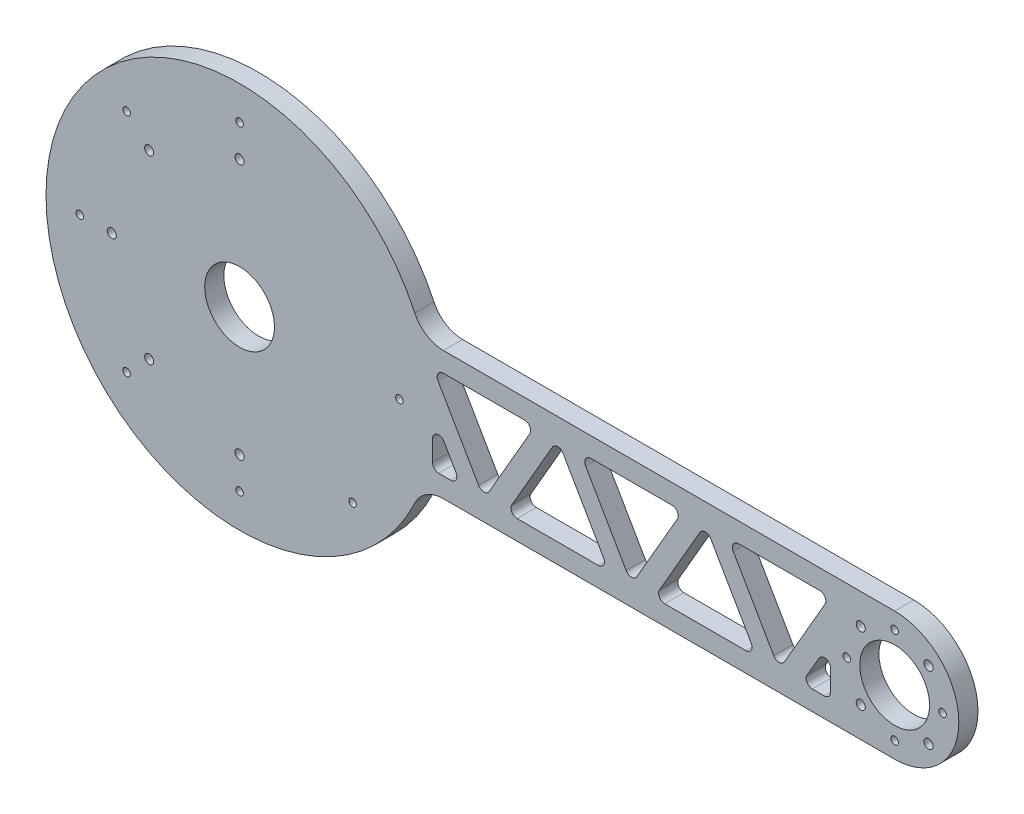
from build123d import *

# Parameters (mm, degrees)
SKETCH1_R              = 11
SKETCH1_R_2            = 1.25
SKETCH1_R_3            = 1.5
BOSS_EXTRUDE1_DEPTH    = 6
FILLET1_R              = 10
CUT_EXTRUDE1_DEPTH     = 234.069195734
FILLET2_R              = 2
MOVE_FACE1_OUTLINE_R   = 11
MOVE_FACE1_OUTLINE_R_2 = 10.92
MOVE_FACE1_OUTLINE_R_3 = 1.25
MOVE_FACE1_OUTLINE_R_4 = 1.17
MOVE_FACE1_OUTLINE_R_5 = 1.5
MOVE_FACE1_OUTLINE_R_6 = 1.42
MOVE_FACE1_DEPTH       = 6


# Read off the part's stored shape, not the designer's step: Move Face1
with BuildPart() as part:
    # Sketch1 → Boss-Extrude1 (new body)
    with BuildSketch(Plane.XY):
        with BuildLine():
            Line((57.098598932, -20), (205, -20))
            ThreePointArc((205, -20), (225, 0), (205, 20))
            Line((205, 20), (57.098598932, 20))
            ThreePointArc((57.098598932, 20), (-60.5, 0), (57.098598932, -20))
        make_face()
        Circle(SKETCH1_R, mode=Mode.SUBTRACT)
        with Locations((205, 0)):
            Circle(SKETCH1_R, mode=Mode.SUBTRACT)
        with Locations((205, -15)):
            Circle(SKETCH1_R_2, mode=Mode.SUBTRACT)
        with Locations((215.606601718, -10.606601718)):
            Circle(SKETCH1_R_3, mode=Mode.SUBTRACT)
        with Locations((190, 0)):
            Circle(SKETCH1_R_2, mode=Mode.SUBTRACT)
        with Locations((194.393398282, -10.606601718)):
            Circle(SKETCH1_R_3, mode=Mode.SUBTRACT)
        with Locations((205, 15)):
            Circle(SKETCH1_R_2, mode=Mode.SUBTRACT)
        with Locations((194.393398282, 10.606601718)):
            Circle(SKETCH1_R_3, mode=Mode.SUBTRACT)
        with Locations((220, 0)):
            Circle(SKETCH1_R_2, mode=Mode.SUBTRACT)
        with Locations((215.606601718, 10.606601718)):
            Circle(SKETCH1_R_3, mode=Mode.SUBTRACT)
        with Locations((0, -40)):
            Circle(SKETCH1_R_3, mode=Mode.SUBTRACT)
        with Locations((0, -50)):
            Circle(SKETCH1_R_2, mode=Mode.SUBTRACT)
        with Locations((-28.284271247, -28.284271247)):
            Circle(SKETCH1_R_3, mode=Mode.SUBTRACT)
        with Locations((-35.355339059, -35.355339059)):
            Circle(SKETCH1_R_2, mode=Mode.SUBTRACT)
        with Locations((-40, 0)):
            Circle(SKETCH1_R_3, mode=Mode.SUBTRACT)
        with Locations((-50, 0)):
            Circle(SKETCH1_R_2, mode=Mode.SUBTRACT)
        with Locations((-28.284271247, 28.284271247)):
            Circle(SKETCH1_R_3, mode=Mode.SUBTRACT)
        with Locations((-35.355339059, 35.355339059)):
            Circle(SKETCH1_R_2, mode=Mode.SUBTRACT)
        with Locations((0, 40)):
            Circle(SKETCH1_R_3, mode=Mode.SUBTRACT)
        with Locations((0, 50)):
            Circle(SKETCH1_R_2, mode=Mode.SUBTRACT)
        with Locations((50, 0)):
            Circle(SKETCH1_R_2, mode=Mode.SUBTRACT)
        with Locations((35.355339059, -35.355339059)):
            Circle(SKETCH1_R_2, mode=Mode.SUBTRACT)
    extrude(amount=BOSS_EXTRUDE1_DEPTH)

    # Fillet1
    fillet1_edges = [part.edges().sort_by_distance(p)[0] for p in [
        (57.098598932, 20, 3),
        (57.098598932, -20, 3),
    ]]
    fillet(fillet1_edges, radius=FILLET1_R)

    # Sketch2 → Cut-Extrude1 (cut, through all)
    with BuildSketch(Plane.XY.offset(6)):
        Polygon((60.292341855, 14), (92.62395693, 14), (76.458149392, -14), align=None)
        Polygon((83.386352623, -14), (99.55216016, 14), (115.717967697, -14), align=None)
        Polygon((106.48036339, 14), (122.646170928, -14), (138.811978465, 14), align=None)
        Polygon((129.574374158, -14), (145.740181695, 14), (161.905989232, -14), align=None)
        Polygon((152.668384925, 14), (168.834192463, -14), (185, 14), align=None)
        Polygon((60.292341855, 2), (60.292341855, -14), (69.529946162, -14), align=None)
        Polygon((185, 2), (185, -14), (175.762395693, -14), align=None)
    extrude(amount=-CUT_EXTRUDE1_DEPTH, mode=Mode.SUBTRACT)

    # Fillet2
    fillet2_edges = [part.edges().sort_by_distance(p)[0] for p in [
        (76.458149392, -14, 3),
        (60.292341855, 14, 3),
        (92.62395693, 14, 3),
        (115.717967697, -14, 3),
        (83.386352623, -14, 3),
        (99.55216016, 14, 3),
        (106.48036339, 14, 3),
        (138.811978465, 14, 3),
        (122.646170928, -14, 3),
        (161.905989232, -14, 3),
        (129.574374158, -14, 3),
        (145.740181695, 14, 3),
        (152.668384925, 14, 3),
        (185, 14, 3),
        (168.834192463, -14, 3),
        (60.292341855, 2, 3),
        (69.529946162, -14, 3),
        (60.292341855, -14, 3),
        (175.762395693, -14, 3),
        (185, 2, 3),
        (185, -14, 3),
    ]]
    fillet(fillet2_edges, radius=FILLET2_R)

    # Move Face1 outline → Move Face1 (add)
    # profile 1 of 30: a face of its own
    with BuildSketch(Plane.XY):
        with BuildLine():
            ThreePointArc((54.82147225, 25.778723404), (-60.58, 0), (54.82147225, -25.778723404))
            ThreePointArc((54.82147225, -25.778723404), (58.481964323, -21.624993617), (63.798510954, -20.08))
            Line((63.798510954, -20.08), (205, -20.08))
            ThreePointArc((205, -20.08), (225.08, 0), (205, 20.08))
            Line((205, 20.08), (63.798510954, 20.08))
            ThreePointArc((63.798510954, 20.08), (58.481964323, 21.624993617), (54.82147225, 25.778723404))
        make_face()
        with BuildLine():
            ThreePointArc((63.798510954, -20), (58.439088947, -21.557453243), (54.749076776, -25.744680851))
            ThreePointArc((54.749076776, -25.744680851), (-60.5, 0), (54.749076776, 25.744680851))
            ThreePointArc((54.749076776, 25.744680851), (58.439088947, 21.557453243), (63.798510954, 20))
            Line((63.798510954, 20), (205, 20))
            ThreePointArc((205, 20), (225, 0), (205, -20))
            Line((205, -20), (63.798510954, -20))
        make_face(mode=Mode.SUBTRACT)
    # profile 2 of 30: a face of its own
    with BuildSketch(Plane.XY):
        Circle(MOVE_FACE1_OUTLINE_R)
        Circle(MOVE_FACE1_OUTLINE_R_2, mode=Mode.SUBTRACT)
    # profile 3 of 30: a face of its own
    with BuildSketch(Plane.XY):
        with Locations((205, 0)):
            Circle(MOVE_FACE1_OUTLINE_R)
        with Locations((205, 0)):
            Circle(MOVE_FACE1_OUTLINE_R_2, mode=Mode.SUBTRACT)
    # profile 4 of 30: a face of its own
    with BuildSketch(Plane.XY):
        with Locations((205, -15)):
            Circle(MOVE_FACE1_OUTLINE_R_3)
        with Locations((205, -15)):
            Circle(MOVE_FACE1_OUTLINE_R_4, mode=Mode.SUBTRACT)
    # profile 5 of 30: a face of its own
    with BuildSketch(Plane.XY):
        with Locations((215.606601718, -10.606601718)):
            Circle(MOVE_FACE1_OUTLINE_R_5)
        with Locations((215.606601718, -10.606601718)):
            Circle(MOVE_FACE1_OUTLINE_R_6, mode=Mode.SUBTRACT)
    # profile 6 of 30: a face of its own
    with BuildSketch(Plane.XY):
        with Locations((190, 0)):
            Circle(MOVE_FACE1_OUTLINE_R_3)
        with Locations((190, 0)):
            Circle(MOVE_FACE1_OUTLINE_R_4, mode=Mode.SUBTRACT)
    # profile 7 of 30: a face of its own
    with BuildSketch(Plane.XY):
        with Locations((194.393398282, -10.606601718)):
            Circle(MOVE_FACE1_OUTLINE_R_5)
        with Locations((194.393398282, -10.606601718)):
            Circle(MOVE_FACE1_OUTLINE_R_6, mode=Mode.SUBTRACT)
    # profile 8 of 30: a face of its own
    with BuildSketch(Plane.XY):
        with Locations((205, 15)):
            Circle(MOVE_FACE1_OUTLINE_R_3)
        with Locations((205, 15)):
            Circle(MOVE_FACE1_OUTLINE_R_4, mode=Mode.SUBTRACT)
    # profile 9 of 30: a face of its own
    with BuildSketch(Plane.XY):
        with Locations((194.393398282, 10.606601718)):
            Circle(MOVE_FACE1_OUTLINE_R_5)
        with Locations((194.393398282, 10.606601718)):
            Circle(MOVE_FACE1_OUTLINE_R_6, mode=Mode.SUBTRACT)
    # profile 10 of 30: a face of its own
    with BuildSketch(Plane.XY):
        with Locations((220, 0)):
            Circle(MOVE_FACE1_OUTLINE_R_3)
        with Locations((220, 0)):
            Circle(MOVE_FACE1_OUTLINE_R_4, mode=Mode.SUBTRACT)
    # profile 11 of 30: a face of its own
    with BuildSketch(Plane.XY):
        with Locations((215.606601718, 10.606601718)):
            Circle(MOVE_FACE1_OUTLINE_R_5)
        with Locations((215.606601718, 10.606601718)):
            Circle(MOVE_FACE1_OUTLINE_R_6, mode=Mode.SUBTRACT)
    # profile 12 of 30: a face of its own
    with BuildSketch(Plane.XY):
        with Locations((0, -40)):
            Circle(MOVE_FACE1_OUTLINE_R_5)
        with Locations((0, -40)):
            Circle(MOVE_FACE1_OUTLINE_R_6, mode=Mode.SUBTRACT)
    # profile 13 of 30: a face of its own
    with BuildSketch(Plane.XY):
        with Locations((0, -50)):
            Circle(MOVE_FACE1_OUTLINE_R_3)
        with Locations((0, -50)):
            Circle(MOVE_FACE1_OUTLINE_R_4, mode=Mode.SUBTRACT)
    # profile 14 of 30: a face of its own
    with BuildSketch(Plane.XY):
        with Locations((-28.284271247, -28.284271247)):
            Circle(MOVE_FACE1_OUTLINE_R_5)
        with Locations((-28.284271247, -28.284271247)):
            Circle(MOVE_FACE1_OUTLINE_R_6, mode=Mode.SUBTRACT)
    # profile 15 of 30: a face of its own
    with BuildSketch(Plane.XY):
        with Locations((-35.355339059, -35.355339059)):
            Circle(MOVE_FACE1_OUTLINE_R_3)
        with Locations((-35.355339059, -35.355339059)):
            Circle(MOVE_FACE1_OUTLINE_R_4, mode=Mode.SUBTRACT)
    # profile 16 of 30: a face of its own
    with BuildSketch(Plane.XY):
        with Locations((-40, 0)):
            Circle(MOVE_FACE1_OUTLINE_R_5)
        with Locations((-40, 0)):
            Circle(MOVE_FACE1_OUTLINE_R_6, mode=Mode.SUBTRACT)
    # profile 17 of 30: a face of its own
    with BuildSketch(Plane.XY):
        with Locations((-50, 0)):
            Circle(MOVE_FACE1_OUTLINE_R_3)
        with Locations((-50, 0)):
            Circle(MOVE_FACE1_OUTLINE_R_4, mode=Mode.SUBTRACT)
    # profile 18 of 30: a face of its own
    with BuildSketch(Plane.XY):
        with Locations((-28.284271247, 28.284271247)):
            Circle(MOVE_FACE1_OUTLINE_R_5)
        with Locations((-28.284271247, 28.284271247)):
            Circle(MOVE_FACE1_OUTLINE_R_6, mode=Mode.SUBTRACT)
    # profile 19 of 30: a face of its own
    with BuildSketch(Plane.XY):
        with Locations((-35.355339059, 35.355339059)):
            Circle(MOVE_FACE1_OUTLINE_R_3)
        with Locations((-35.355339059, 35.355339059)):
            Circle(MOVE_FACE1_OUTLINE_R_4, mode=Mode.SUBTRACT)
    # profile 20 of 30: a face of its own
    with BuildSketch(Plane.XY):
        with Locations((0, 40)):
            Circle(MOVE_FACE1_OUTLINE_R_5)
        with Locations((0, 40)):
            Circle(MOVE_FACE1_OUTLINE_R_6, mode=Mode.SUBTRACT)
    # profile 21 of 30: a face of its own
    with BuildSketch(Plane.XY):
        with Locations((0, 50)):
            Circle(MOVE_FACE1_OUTLINE_R_3)
        with Locations((0, 50)):
            Circle(MOVE_FACE1_OUTLINE_R_4, mode=Mode.SUBTRACT)
    # profile 22 of 30: a face of its own
    with BuildSketch(Plane.XY):
        with Locations((50, 0)):
            Circle(MOVE_FACE1_OUTLINE_R_3)
        with Locations((50, 0)):
            Circle(MOVE_FACE1_OUTLINE_R_4, mode=Mode.SUBTRACT)
    # profile 23 of 30: a face of its own
    with BuildSketch(Plane.XY):
        with Locations((35.355339059, -35.355339059)):
            Circle(MOVE_FACE1_OUTLINE_R_3)
        with Locations((35.355339059, -35.355339059)):
            Circle(MOVE_FACE1_OUTLINE_R_4, mode=Mode.SUBTRACT)
    # profile 24 of 30: a face of its own
    with BuildSketch(Plane.XY):
        with BuildLine():
            ThreePointArc((63.75644347, 14), (62.024392663, 13), (62.024392663, 11))
            Line((62.024392663, 11), (74.726098585, -11))
            ThreePointArc((74.726098585, -11), (76.458149392, -12), (78.1902002, -11))
            Line((78.1902002, -11), (90.891906122, 11))
            ThreePointArc((90.891906122, 11), (90.891906122, 13), (89.159855315, 14))
            Line((89.159855315, 14), (63.75644347, 14))
        make_face()
        with BuildLine():
            Line((74.795380617, -10.96), (62.093674695, 11.04))
            ThreePointArc((62.093674695, 11.04), (62.093674695, 12.96), (63.75644347, 13.92))
            Line((63.75644347, 13.92), (89.159855315, 13.92))
            ThreePointArc((89.159855315, 13.92), (90.82262409, 12.96), (90.82262409, 11.04))
            Line((90.82262409, 11.04), (78.120918168, -10.96))
            ThreePointArc((78.120918168, -10.96), (76.458149393, -11.92), (74.795380617, -10.96))
        make_face(mode=Mode.SUBTRACT)
    # profile 25 of 30: a face of its own
    with BuildSketch(Plane.XY):
        with BuildLine():
            ThreePointArc((137.079927657, 11), (137.079927657, 13), (135.34787685, 14))
            Line((135.34787685, 14), (109.944465005, 14))
            ThreePointArc((109.944465005, 14), (108.212414198, 13), (108.212414198, 11))
            Line((108.212414198, 11), (120.91412012, -11))
            ThreePointArc((120.91412012, -11), (122.646170928, -12), (124.378221735, -11))
            Line((124.378221735, -11), (137.079927657, 11))
        make_face()
        with BuildLine():
            Line((109.944465005, 13.92), (135.34787685, 13.92))
            ThreePointArc((135.34787685, 13.92), (137.010645625, 12.96), (137.010645625, 11.04))
            Line((137.010645625, 11.04), (124.308939703, -10.96))
            ThreePointArc((124.308939703, -10.96), (122.646170927, -11.92), (120.983402152, -10.96))
            Line((120.983402152, -10.96), (108.28169623, 11.04))
            ThreePointArc((108.28169623, 11.04), (108.28169623, 12.96), (109.944465005, 13.92))
        make_face(mode=Mode.SUBTRACT)
    # profile 26 of 30: a face of its own
    with BuildSketch(Plane.XY):
        with BuildLine():
            ThreePointArc((183.267949192, 11), (183.267949192, 13), (181.535898385, 14))
            Line((181.535898385, 14), (156.132486541, 14))
            ThreePointArc((156.132486541, 14), (154.400435733, 13), (154.400435733, 11))
            Line((154.400435733, 11), (167.102141655, -11))
            ThreePointArc((167.102141655, -11), (168.834192462, -12), (170.56624327, -11))
            Line((170.56624327, -11), (183.267949192, 11))
        make_face()
        with BuildLine():
            Line((156.132486541, 13.92), (181.535898385, 13.92))
            ThreePointArc((181.535898385, 13.92), (183.19866716, 12.96), (183.19866716, 11.04))
            Line((183.19866716, 11.04), (170.496961238, -10.96))
            ThreePointArc((170.496961238, -10.96), (168.834192462, -11.92), (167.171423687, -10.96))
            Line((167.171423687, -10.96), (154.469717765, 11.04))
            ThreePointArc((154.469717765, 11.04), (154.469717765, 12.96), (156.132486541, 13.92))
        make_face(mode=Mode.SUBTRACT)
    # profile 27 of 30: a face of its own
    with BuildSketch(Plane.XY):
        with BuildLine():
            ThreePointArc((85.11840343, -11), (85.11840343, -13), (86.850454238, -14))
            Line((86.850454238, -14), (112.253866082, -14))
            ThreePointArc((112.253866082, -14), (113.98591689, -13), (113.98591689, -11))
            Line((113.98591689, -11), (101.284210968, 11))
            ThreePointArc((101.284210968, 11), (99.55216016, 12), (97.820109352, 11))
            Line((97.820109352, 11), (85.11840343, -11))
        make_face()
        with BuildLine():
            Line((112.253866082, -13.92), (86.850454238, -13.92))
            ThreePointArc((86.850454238, -13.92), (85.187685462, -12.96), (85.187685462, -11.04))
            Line((85.187685462, -11.04), (97.889391385, 10.96))
            ThreePointArc((97.889391385, 10.96), (99.55216016, 11.92), (101.214928935, 10.96))
            Line((101.214928935, 10.96), (113.916634857, -11.04))
            ThreePointArc((113.916634857, -11.04), (113.916634857, -12.96), (112.253866082, -13.92))
        make_face(mode=Mode.SUBTRACT)
    # profile 28 of 30: a face of its own
    with BuildSketch(Plane.XY):
        with BuildLine():
            ThreePointArc((131.306424965, -11), (131.306424965, -13), (133.038475773, -14))
            Line((133.038475773, -14), (158.441887617, -14))
            ThreePointArc((158.441887617, -14), (160.173938425, -13), (160.173938425, -11))
            Line((160.173938425, -11), (147.472232503, 11))
            ThreePointArc((147.472232503, 11), (145.740181696, 12), (144.008130888, 11))
            Line((144.008130888, 11), (131.306424965, -11))
        make_face()
        with BuildLine():
            Line((158.441887617, -13.92), (133.038475773, -13.92))
            ThreePointArc((133.038475773, -13.92), (131.375706998, -12.96), (131.375706998, -11.04))
            Line((131.375706998, -11.04), (144.07741292, 10.96))
            ThreePointArc((144.07741292, 10.96), (145.740181695, 11.92), (147.40295047, 10.96))
            Line((147.40295047, 10.96), (160.104656393, -11.04))
            ThreePointArc((160.104656393, -11.04), (160.104656393, -12.96), (158.441887617, -13.92))
        make_face(mode=Mode.SUBTRACT)
    # profile 29 of 30: a face of its own
    with BuildSketch(Plane.XY):
        with BuildLine():
            ThreePointArc((60.292341855, -12), (60.878128293, -13.414213562), (62.292341855, -14))
            Line((62.292341855, -14), (66.065844547, -14))
            ThreePointArc((66.065844547, -14), (67.797895355, -13), (67.797895355, -11))
            Line((67.797895355, -11), (64.024392663, -4.464101615))
            ThreePointArc((64.024392663, -4.464101615), (61.774703765, -3.532249963), (60.292341855, -5.464101615))
            Line((60.292341855, -5.464101615), (60.292341855, -12))
        make_face()
        with BuildLine():
            Line((66.065844547, -13.92), (62.292341855, -13.92))
            ThreePointArc((62.292341855, -13.92), (60.934696835, -13.35764502), (60.372341855, -12))
            Line((60.372341855, -12), (60.372341855, -5.464101615))
            ThreePointArc((60.372341855, -5.464101615), (61.795409288, -3.609524029), (63.95511063, -4.504101615))
            Line((63.95511063, -4.504101615), (67.728613322, -11.04))
            ThreePointArc((67.728613322, -11.04), (67.728613322, -12.96), (66.065844547, -13.92))
        make_face(mode=Mode.SUBTRACT)
    # profile 30 of 30: a face of its own
    with BuildSketch(Plane.XY):
        with BuildLine():
            ThreePointArc((177.494446501, -11), (177.494446501, -13), (179.226497308, -14))
            Line((179.226497308, -14), (183, -14))
            ThreePointArc((183, -14), (184.414213562, -13.414213562), (185, -12))
            Line((185, -12), (185, -5.464101615))
            ThreePointArc((185, -5.464101615), (183.51763809, -3.532249963), (181.267949192, -4.464101615))
            Line((181.267949192, -4.464101615), (177.494446501, -11))
        make_face()
        with BuildLine():
            Line((183, -13.92), (179.226497308, -13.92))
            ThreePointArc((179.226497308, -13.92), (177.563728533, -12.96), (177.563728533, -11.04))
            Line((177.563728533, -11.04), (181.337231225, -4.504101615))
            ThreePointArc((181.337231225, -4.504101615), (183.496932567, -3.609524029), (184.92, -5.464101615))
            Line((184.92, -5.464101615), (184.92, -12))
            ThreePointArc((184.92, -12), (184.35764502, -13.35764502), (183, -13.92))
        make_face(mode=Mode.SUBTRACT)
    extrude(amount=MOVE_FACE1_DEPTH)


solid = part.part
